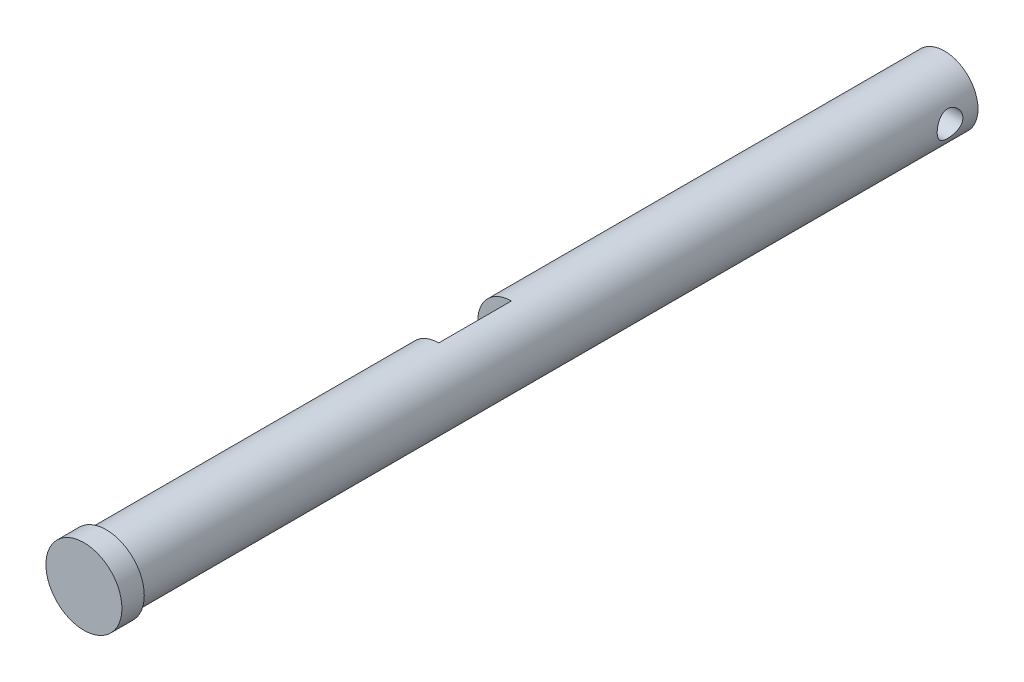
from build123d import *

# Parameters (mm, degrees)
SKETCH1_R                      = 3
BOSS_EXTRUDE1_DEPTH            = 38.75
BOSS_EXTRUDE2_DEPTH            = 6.5
SKETCH3_R                      = 3
BOSS_EXTRUDE3_DEPTH            = 29.75
SKETCH4_R                      = 3.4
BOSS_EXTRUDE4_DEPTH            = 2
CUT_EXTRUDE1_REACH             = 79.15
SKETCH5_R                      = 1.15
CUT_EXTRUDE1_DIRECTION_2_REACH = 79.15


with BuildPart() as part:
    # Sketch1 → Boss-Extrude1 (new body)
    with BuildSketch(Plane.XY):
        Circle(SKETCH1_R)
    extrude(amount=BOSS_EXTRUDE1_DEPTH)

    # Sketch2 → Boss-Extrude2 (add)
    with BuildSketch(Plane.XY.offset(38.75)):
        with BuildLine():
            Line((0, 3), (0, -3))
            ThreePointArc((0, -3), (3, 0), (0, 3))
        make_face()
    extrude(amount=BOSS_EXTRUDE2_DEPTH)

    # Sketch3 → Boss-Extrude3 (add)
    with BuildSketch(Plane.XY.offset(45.25)):
        Circle(SKETCH3_R)
    extrude(amount=BOSS_EXTRUDE3_DEPTH)

    # Sketch4 → Boss-Extrude4 (add)
    with BuildSketch(Plane.XY.offset(75)):
        Circle(SKETCH4_R)
    extrude(amount=BOSS_EXTRUDE4_DEPTH)

    # Sketch5 → Cut-Extrude1 (cut, up to next)
    with BuildSketch(Plane(origin=(0, 0, 0), x_dir=(0, 0, -1), z_dir=(1, 0, 0)), mode=Mode.PRIVATE) as cut_extrude1_sk1:
        with Locations((-2.5, 0)):
            Circle(SKETCH5_R)
    cut_extrude1_tool1 = extrude(cut_extrude1_sk1.sketch, amount=-CUT_EXTRUDE1_REACH, mode=Mode.PRIVATE) & part.part
    add(cut_extrude1_tool1.solids().sort_by_distance((0, 0, 2.5))[0], mode=Mode.SUBTRACT)

    # Sketch5 → Cut-Extrude1 direction 2 (cut, up to next)
    with BuildSketch(Plane(origin=(0, 0, 0), x_dir=(0, 0, -1), z_dir=(1, 0, 0)), mode=Mode.PRIVATE) as cut_extrude1_direction_2_sk1:
        with Locations((-2.5, 0)):
            Circle(SKETCH5_R)
    cut_extrude1_direction_2_tool1 = extrude(cut_extrude1_direction_2_sk1.sketch, amount=CUT_EXTRUDE1_DIRECTION_2_REACH, mode=Mode.PRIVATE) & part.part
    add(cut_extrude1_direction_2_tool1.solids().sort_by_distance((0, 0, 2.5))[0], mode=Mode.SUBTRACT)


solid = part.part
